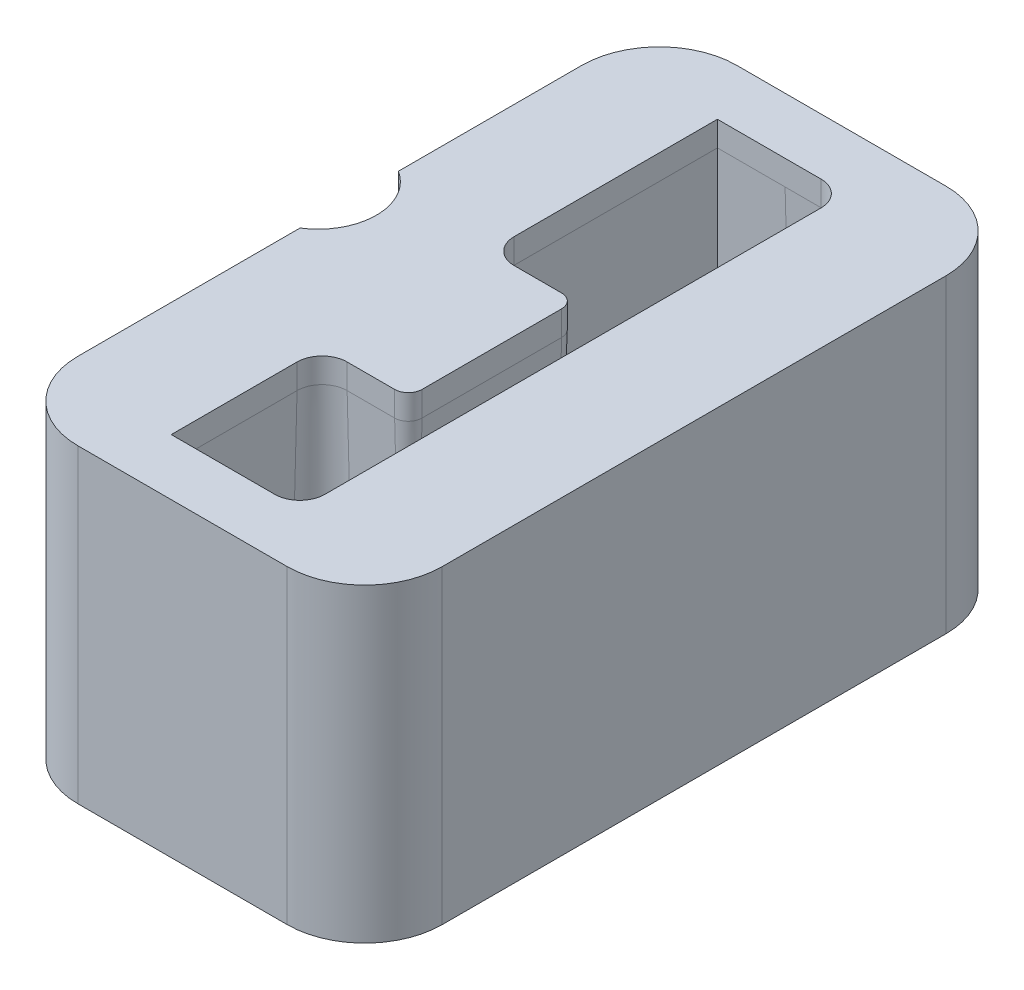
from build123d import *

# Parameters (mm, degrees)
SKETCH1_W                   = 47
SKETCH1_H                   = 85
BOSS_EXTRUDE1_DEPTH         = 40
FILLET1_R                   = 10
CUT_EXTRUDE1_REACH          = 64.917
M6_TAPPED_HOLE1_D           = 5
M6_TAPPED_HOLE1_DEPTH       = 17
M6_TAPPED_HOLE1_CSINK_D     = 6.05
M6_TAPPED_HOLE1_CSINK_ANGLE = 90
M6_TAPPED_HOLE1_TIP         = 1.502151548
SKETCH9_R                   = 7.5
CUT_EXTRUDE2_DEPTH          = 268.695101375
SKETCH10_R                  = 10
CUT_EXTRUDE3_DEPTH          = 30


with BuildPart() as part:
    # Sketch1 → Boss-Extrude1 (new body)
    with BuildSketch(Plane(origin=(0, 0, 0), x_dir=(1, 0, 0), z_dir=(0, 1, 0))):
        Rectangle(SKETCH1_W, SKETCH1_H)
    extrude(amount=-BOSS_EXTRUDE1_DEPTH)

    # Fillet1
    fillet1_edges = [part.edges().sort_by_distance(p)[0] for p in [
        (-23.5, -20, -42.5),
        (23.5, -20, -42.5),
        (-23.5, -20, 42.5),
        (23.5, -20, 42.5),
    ]]
    fillet(fillet1_edges, radius=FILLET1_R)

    # Sketch3 → Cut-Extrude1 (cut, up to next)
    with BuildSketch(Plane(origin=(0, 0, 0), x_dir=(1, 0, 0), z_dir=(0, 1, 0)), mode=Mode.PRIVATE) as cut_extrude1_sk1:
        with BuildLine():
            Line((4.63, 35.23), (-8.73, 35.23))
            Line((-8.73, 35.23), (-8.73, 9))
            ThreePointArc((-8.73, 9), (-7.783954903, 6.716045097), (-5.5, 5.77))
            Line((-5.5, 5.77), (0.63, 5.77))
            ThreePointArc((0.63, 5.77), (1.881579003, 5.251579003), (2.4, 4))
            Line((2.4, 4), (2.4, -14))
            ThreePointArc((2.4, -14), (1.881579003, -15.251579003), (0.63, -15.77))
            Line((0.63, -15.77), (-5.5, -15.77))
            ThreePointArc((-5.5, -15.77), (-7.783954903, -16.716045097), (-8.73, -19))
            Line((-8.73, -19), (-8.73, -35.23))
            Line((-8.73, -35.23), (4.63, -35.23))
            ThreePointArc((4.63, -35.23), (6.913954903, -34.283954903), (7.86, -32))
            Line((7.86, -32), (7.86, 32))
            ThreePointArc((7.86, 32), (6.913954903, 34.283954903), (4.63, 35.23))
        make_face()
    cut_extrude1_tool1 = extrude(cut_extrude1_sk1.sketch, amount=-CUT_EXTRUDE1_REACH, mode=Mode.PRIVATE) & part.part
    add(cut_extrude1_tool1.solids().sort_by_distance((-2.05, 0, -34.506133))[0], mode=Mode.SUBTRACT)

    # Cut-Sweep1: sweep along a path in Sketch5
    with BuildLine(Plane(origin=(0, 0, 0), x_dir=(1, 0, 0), z_dir=(0, 1, 0))) as cut_sweep1_path:
        Line((-8.73, -35.23), (4.63, -35.23))
        ThreePointArc((4.63, -35.23), (6.913954903, -34.283954903), (7.86, -32))
        Line((7.86, -32), (7.86, 32))
        ThreePointArc((7.86, 32), (6.913954903, 34.283954903), (4.63, 35.23))
        Line((4.63, 35.23), (-8.73, 35.23))
        Line((-8.73, 35.23), (-8.73, 9))
        ThreePointArc((-8.73, 9), (-7.783954903, 6.716045097), (-5.5, 5.77))
        Line((-5.5, 5.77), (0.63, 5.77))
        ThreePointArc((0.63, 5.77), (1.881579003, 5.251579003), (2.4, 4))
        Line((2.4, 4), (2.4, -14))
        ThreePointArc((2.4, -14), (1.881579003, -15.251579003), (0.63, -15.77))
        Line((0.63, -15.77), (-5.5, -15.77))
        ThreePointArc((-5.5, -15.77), (-7.783954903, -16.716045097), (-8.73, -19))
        Line((-8.73, -19), (-8.73, -35.23))
    # Sketch4 → Cut-Sweep1 (sweep, cut)
    with BuildSketch(Plane(origin=(0, 0, 0), x_dir=(0, 0, -1), z_dir=(1, 0, 0))):
        Polygon((35.23, -3.2), (36.193641914, -40), (35.23, -40), align=None)
    sweep(path=cut_sweep1_path.line, transition=Transition.RIGHT, mode=Mode.SUBTRACT)

    # M6 Tapped Hole1
    with Locations(Plane(origin=(0, -40, 0), x_dir=(-1, 0, 0), z_dir=(0, -1, 0))):
        with Locations((-16.5, 35.5), (16.5, 35.5), (16.5, -35.5), (-16.5, -35.5)):
            CounterSinkHole(M6_TAPPED_HOLE1_D / 2, M6_TAPPED_HOLE1_CSINK_D / 2, depth=M6_TAPPED_HOLE1_DEPTH, counter_sink_angle=M6_TAPPED_HOLE1_CSINK_ANGLE)
            with Locations((0, 0, -(M6_TAPPED_HOLE1_DEPTH + M6_TAPPED_HOLE1_TIP / 2))):  # 118° drill point
                Cone(0, M6_TAPPED_HOLE1_D / 2, M6_TAPPED_HOLE1_TIP, mode=Mode.SUBTRACT)

    # Sketch9 → Cut-Extrude2 (cut, through all)
    with BuildSketch(Plane(origin=(236.38, 0, 7.73), x_dir=(1, 0, 0), z_dir=(0, 1, 0))):
        with Locations((-263.88, 10.23)):
            Circle(SKETCH9_R)
    extrude(amount=-CUT_EXTRUDE2_DEPTH, mode=Mode.SUBTRACT)

    # Sketch10 → Cut-Extrude3 (cut)
    with BuildSketch(Plane(origin=(236.38, -40, 7.73), x_dir=(1, 0, 0), z_dir=(0, -1, 0))):
        with Locations((-263.88, -10.23)):
            Circle(SKETCH10_R)
    extrude(amount=-CUT_EXTRUDE3_DEPTH, mode=Mode.SUBTRACT)


solid = part.part
